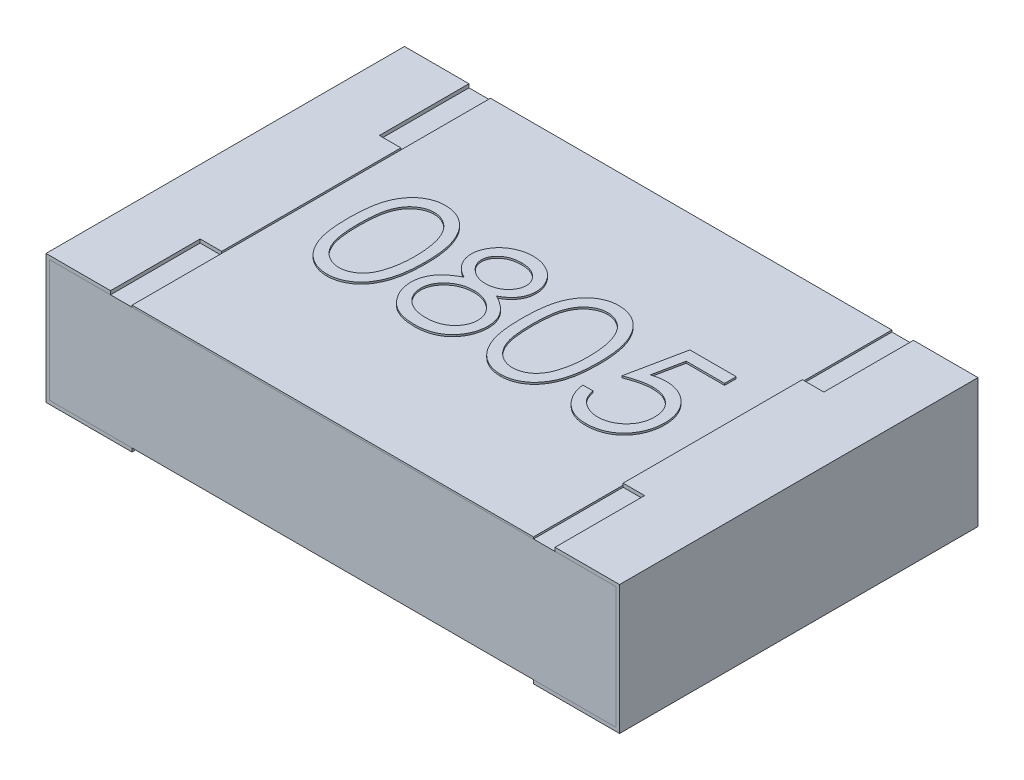
from build123d import *

# Parameters (mm, degrees)
CROQUIS1_W              = 2
CROQUIS1_H              = 1.25
SALIENTE_EXTRUIR1_DEPTH = 0.45
CROQUIS2_W              = 1.4
CROQUIS2_H              = 0.0125
CORTAR_EXTRUIR1_DEPTH   = 2.662828915
CROQUIS3_W              = 0.075
CROQUIS3_H              = 0.3125
CORTAR_EXTRUIR3_DEPTH   = 0.0125
CROQUIS4_W              = 1.4
CROQUIS4_H              = 1.25
SALIENTE_EXTRUIR2_DEPTH = 0.00625
SALIENTE_EXTRUIR2_TAPER = 1
SALIENTE_EXTRUIR3_START = 0.44375
SALIENTE_EXTRUIR3_DEPTH = 0.00625


# Read off the part's stored shape, not the designer's step: Saliente-Extruir3
with BuildPart() as part:
    # Croquis1 → Saliente-Extruir1 (new body)
    with BuildSketch(Plane(origin=(0, 0, 0), x_dir=(1, 0, 0), z_dir=(0, 1, 0))):
        Rectangle(CROQUIS1_W, CROQUIS1_H)
    extrude(amount=SALIENTE_EXTRUIR1_DEPTH)

    # Croquis2 → Cortar-Extruir1 (cut, through all)
    with BuildSketch(Plane.XY.offset(0.625)):
        with Locations((0, 0.00625)):
            Rectangle(CROQUIS2_W, CROQUIS2_H)
        with Locations((0, 0.44375)):
            Rectangle(CROQUIS2_W, CROQUIS2_H)
    extrude(amount=-CORTAR_EXTRUIR1_DEPTH, mode=Mode.SUBTRACT)

    # Croquis3 → Cortar-Extruir3 (cut)
    with BuildSketch(Plane(origin=(0, 0.45, 0), x_dir=(1, 0, 0), z_dir=(0, 1, 0))):
        with Locations((-0.7375, -0.46875)):
            Rectangle(CROQUIS3_W, CROQUIS3_H)
        with Locations((-0.7375, 0.46875)):
            Rectangle(CROQUIS3_W, CROQUIS3_H)
        with Locations((0.7375, 0.46875)):
            Rectangle(CROQUIS3_W, CROQUIS3_H)
        with Locations((0.7375, -0.46875)):
            Rectangle(CROQUIS3_W, CROQUIS3_H)
    extrude(amount=-CORTAR_EXTRUIR3_DEPTH, mode=Mode.SUBTRACT)

    # Croquis4 → Saliente-Extruir2 (add)
    with BuildSketch(Plane(origin=(0, 0.4375, 0), x_dir=(1, 0, 0), z_dir=(0, 1, 0))):
        Rectangle(CROQUIS4_W, CROQUIS4_H)
    extrude(amount=SALIENTE_EXTRUIR2_DEPTH, taper=SALIENTE_EXTRUIR2_TAPER)

    # Saliente-Extruir3 outline → Saliente-Extruir3 (add)
    # profile 1 of 4: a face of its own
    with BuildSketch(Plane(origin=(0, 0, 0), x_dir=(1, 0, 0), z_dir=(0, 1, 0)).offset(SALIENTE_EXTRUIR3_START)):
        with BuildLine():
            add(Edge.make_bspline(
                [(-0.448233935, -0.197441498), (-0.451337673, -0.197389062), (-0.457457638, -0.197285669), (-0.466525997, -0.196215969), (-0.475327881, -0.19449618), (-0.483906723, -0.19208815), (-0.492306538, -0.189140619), (-0.500412866, -0.185300464), (-0.508315839, -0.180877839), (-0.515994372, -0.175841153), (-0.523304178, -0.17007067), (-0.530286391, -0.163688234), (-0.536765605, -0.156534576), (-0.54279609, -0.14872265), (-0.54852749, -0.140324328), (-0.553799614, -0.131224942), (-0.558676126, -0.121460575), (-0.563133541, -0.11096814), (-0.56708557, -0.099594531), (-0.570576497, -0.087209631), (-0.573332808, -0.073704127), (-0.57569208, -0.05918649), (-0.577595015, -0.043594338), (-0.578894155, -0.026919204), (-0.579697107, -0.009171481), (-0.579768512, 0.003002104), (-0.579805201, 0.009257041)],
                knots=[0, 0, 0, 0, 0.033787146, 0.066621658, 0.099284878, 0.131361165, 0.163585188, 0.196103927, 0.228902254, 0.262158056, 0.295991222, 0.330217846, 0.365059826, 0.400950737, 0.437620382, 0.475707529, 0.515380692, 0.556413541, 0.59976483, 0.646424156, 0.696431445, 0.749781518, 0.806573307, 0.867435532, 0.931886753, 1, 1, 1, 1], degree=3))
            add(Edge.make_bspline(
                [(-0.312405718, 0.009257041), (-0.312478981, 0.003238946), (-0.31262173, -0.008487068), (-0.313361423, -0.025637272), (-0.31481846, -0.041828055), (-0.316641071, -0.057098246), (-0.319165401, -0.07138429), (-0.322269258, -0.084735621), (-0.325715504, -0.097209897), (-0.329969554, -0.108704925), (-0.334625672, -0.119381061), (-0.339691566, -0.129350576), (-0.345118906, -0.138701587), (-0.351031854, -0.147359248), (-0.35733436, -0.155384887), (-0.364161318, -0.162636839), (-0.37132028, -0.169289843), (-0.378899965, -0.175209861), (-0.386816865, -0.180391522), (-0.394907765, -0.185025505), (-0.403316223, -0.188762107), (-0.411851687, -0.191970516), (-0.420636247, -0.194421705), (-0.429658952, -0.196116572), (-0.438873908, -0.197305244), (-0.445103122, -0.197395923), (-0.448233935, -0.197441498)],
                knots=[0, 0, 0, 0, 0.06506329, 0.126773166, 0.185515763, 0.240764679, 0.292979796, 0.342250373, 0.388919286, 0.432775664, 0.474628433, 0.514774691, 0.553605893, 0.591426406, 0.62802812, 0.663803634, 0.698984336, 0.733591489, 0.767628469, 0.801208348, 0.83426384, 0.866980695, 0.899719742, 0.932701912, 0.966175883, 1, 1, 1, 1], degree=3))
            add(Edge.make_bspline(
                [(-0.448233935, 0.21627091), (-0.445104182, 0.216216061), (-0.43888009, 0.216106984), (-0.429678161, 0.215058623), (-0.420688818, 0.213319089), (-0.411950383, 0.210854349), (-0.403391078, 0.207796534), (-0.395077852, 0.203963863), (-0.386959067, 0.19950247), (-0.379163742, 0.194260197), (-0.371606297, 0.188415439), (-0.364472366, 0.18180831), (-0.357761298, 0.174505525), (-0.351388867, 0.166585216), (-0.345535865, 0.157895473), (-0.339961951, 0.148587433), (-0.33497287, 0.138498318), (-0.330167889, 0.127796462), (-0.326020407, 0.116185752), (-0.322280033, 0.103731638), (-0.319257829, 0.090287013), (-0.316740435, 0.075922418), (-0.314790218, 0.060585099), (-0.313369835, 0.044307933), (-0.31261953, 0.027080213), (-0.312478229, 0.0153015), (-0.312405718, 0.009257041)],
                knots=[0, 0, 0, 0, 0.033788116, 0.067193932, 0.099862411, 0.132566612, 0.165151173, 0.197913187, 0.231319004, 0.265083278, 0.299255309, 0.334398567, 0.369942824, 0.406283561, 0.44406382, 0.482997707, 0.523354447, 0.56553659, 0.609612924, 0.656390811, 0.705885495, 0.7583245, 0.813831783, 0.872794559, 0.93472223, 1, 1, 1, 1], degree=3))
            add(Edge.make_bspline(
                [(-0.579805201, 0.009257041), (-0.57976832, 0.015564492), (-0.579696677, 0.027816807), (-0.578899673, 0.045670158), (-0.577575682, 0.062418883), (-0.575761236, 0.078063784), (-0.57355319, 0.0926089), (-0.570605586, 0.10601536), (-0.567253509, 0.118345214), (-0.563368517, 0.129638669), (-0.558984827, 0.140047876), (-0.554213624, 0.149765311), (-0.548865557, 0.158776271), (-0.543246277, 0.167224578), (-0.537128318, 0.174971939), (-0.530685784, 0.182127762), (-0.523667224, 0.188526665), (-0.516311223, 0.194356135), (-0.508551183, 0.199466361), (-0.500608297, 0.203967542), (-0.492427893, 0.207812891), (-0.483987638, 0.210836384), (-0.475363393, 0.213333717), (-0.466525009, 0.215041525), (-0.457457894, 0.21611608), (-0.451337759, 0.21621881), (-0.448233935, 0.21627091)],
                knots=[0, 0, 0, 0, 0.068594622, 0.133246042, 0.194312586, 0.251279223, 0.304513439, 0.354234907, 0.400480589, 0.443410755, 0.484014869, 0.523252301, 0.561042373, 0.597900239, 0.633518489, 0.668314351, 0.702495671, 0.736685354, 0.770293169, 0.803437255, 0.835912952, 0.868460246, 0.900846538, 0.933466525, 0.966257575, 1, 1, 1, 1], degree=3))
        make_face()
        with BuildLine():
            add(Edge.make_bspline(
                [(-0.447051449, 0.175908724), (-0.451403972, 0.175680313), (-0.460116947, 0.175223075), (-0.472985191, 0.171996877), (-0.485320076, 0.166373543), (-0.495129459, 0.160194835), (-0.502647458, 0.154310045), (-0.507941319, 0.149206905), (-0.512905005, 0.143624803), (-0.51747758, 0.137507987), (-0.521760245, 0.130934286), (-0.525693423, 0.123851985), (-0.529237153, 0.116225195), (-0.532507346, 0.108060383), (-0.535382687, 0.099112499), (-0.53775444, 0.089243972), (-0.539945516, 0.078398036), (-0.541496622, 0.066511197), (-0.542875528, 0.053661595), (-0.543761687, 0.039800599), (-0.544451071, 0.024951608), (-0.544475634, 0.014697401), (-0.544488289, 0.009414706)],
                knots=[0, 0, 0, 0, 0.060386619, 0.120883249, 0.182754619, 0.24781103, 0.2812991, 0.315087624, 0.349702396, 0.384856581, 0.420966197, 0.458511188, 0.497174722, 0.537602048, 0.580503018, 0.62746754, 0.67838821, 0.733983221, 0.793746705, 0.857713672, 0.926697864, 1, 1, 1, 1], degree=3))
            add(Edge.make_bspline(
                [(-0.347722631, 0.009414706), (-0.347784493, 0.014144679), (-0.347905508, 0.023397519), (-0.348368075, 0.036948284), (-0.349562563, 0.049818755), (-0.350889227, 0.062064378), (-0.352845327, 0.073617367), (-0.354954408, 0.084574438), (-0.35778797, 0.094799846), (-0.360814763, 0.104453684), (-0.364279007, 0.113426272), (-0.368092408, 0.121759442), (-0.372165093, 0.129493426), (-0.376588637, 0.136607003), (-0.381310527, 0.143132039), (-0.386455393, 0.148937704), (-0.391819154, 0.154203937), (-0.399331912, 0.160215135), (-0.409167305, 0.166344295), (-0.421405639, 0.171984809), (-0.434141509, 0.175223942), (-0.442751238, 0.175680628), (-0.447051449, 0.175908724)],
                knots=[0, 0, 0, 0, 0.065681198, 0.128486464, 0.18817513, 0.245106131, 0.299448425, 0.350822936, 0.399941681, 0.446671744, 0.491254533, 0.533376344, 0.573852755, 0.612526312, 0.649597136, 0.685532042, 0.720105786, 0.753837663, 0.818925416, 0.880493462, 0.940311334, 1, 1, 1, 1], degree=3))
            add(Edge.make_bspline(
                [(-0.362621954, -0.08951995), (-0.361435539, -0.086008555), (-0.359026609, -0.078878919), (-0.355922009, -0.067819154), (-0.353477011, -0.056215291), (-0.351277354, -0.044136677), (-0.34977597, -0.031494236), (-0.348567512, -0.018327085), (-0.347855706, -0.004625296), (-0.34776747, 0.004683967), (-0.347722631, 0.009414706)],
                knots=[0, 0, 0, 0, 0.110588339, 0.224541754, 0.342503494, 0.464324098, 0.590756033, 0.722227475, 0.858842836, 1, 1, 1, 1], degree=3))
            add(Edge.make_bspline(
                [(-0.447051449, -0.157079312), (-0.442693632, -0.156899661), (-0.433986997, -0.156540731), (-0.421266513, -0.153077798), (-0.40891747, -0.147852878), (-0.399239755, -0.141674717), (-0.39187706, -0.135791049), (-0.38660183, -0.130774689), (-0.381760041, -0.125157775), (-0.377167859, -0.119097472), (-0.372956053, -0.112477996), (-0.369126079, -0.105331178), (-0.365631144, -0.097637171), (-0.363639983, -0.09226606), (-0.362621954, -0.08951995)],
                knots=[0, 0, 0, 0, 0.112813401, 0.225393884, 0.339594815, 0.45967541, 0.52173519, 0.583925839, 0.648174145, 0.713881038, 0.781004455, 0.851450928, 0.924050693, 1, 1, 1, 1], degree=3))
            add(Edge.make_bspline(
                [(-0.544488289, 0.009414706), (-0.544474858, 0.004158398), (-0.544448793, -0.006043063), (-0.543767848, -0.020867192), (-0.542840213, -0.034693671), (-0.541643732, -0.047540055), (-0.539866888, -0.059362861), (-0.53787598, -0.070243404), (-0.535453167, -0.080124103), (-0.53258657, -0.089072759), (-0.529321486, -0.09724124), (-0.525756557, -0.104842153), (-0.521926854, -0.111965287), (-0.517640831, -0.118546661), (-0.512972981, -0.124607736), (-0.508028737, -0.130255791), (-0.502623575, -0.135292653), (-0.495146059, -0.141333567), (-0.485274441, -0.147576), (-0.472836552, -0.153011915), (-0.460055953, -0.156428043), (-0.451381258, -0.156862474), (-0.447051449, -0.157079312)],
                knots=[0, 0, 0, 0, 0.072951066, 0.141583694, 0.20592646, 0.265301357, 0.320597233, 0.371816503, 0.41878977, 0.461698729, 0.502133582, 0.540804315, 0.578180525, 0.614296865, 0.649678243, 0.68429946, 0.718358953, 0.752080865, 0.817652439, 0.879722076, 0.93996556, 1, 1, 1, 1], degree=3))
        make_face(mode=Mode.SUBTRACT)
    # profile 2 of 4: a face of its own
    with BuildSketch(Plane(origin=(0, 0, 0), x_dir=(1, 0, 0), z_dir=(0, 1, 0)).offset(SALIENTE_EXTRUIR3_START)):
        with BuildLine():
            add(Edge.make_bspline(
                [(-0.029870415, 0.114182959), (-0.030031714, 0.109912957), (-0.030348495, 0.101526916), (-0.033013257, 0.089301976), (-0.037501011, 0.077853358), (-0.043628199, 0.067051154), (-0.051614129, 0.05709127), (-0.0613522, 0.047847054), (-0.072764774, 0.039242568), (-0.081339359, 0.0343868), (-0.085762583, 0.031881938)],
                knots=[0, 0, 0, 0, 0.121904041, 0.239412608, 0.355410104, 0.472090729, 0.592858982, 0.718703468, 0.854892383, 1, 1, 1, 1], degree=3))
            add(Edge.make_bspline(
                [(-0.141575919, 0.21627091), (-0.13657202, 0.216108287), (-0.126704902, 0.215787612), (-0.112201067, 0.213113075), (-0.09832348, 0.208645986), (-0.085119998, 0.202585916), (-0.072826994, 0.195121533), (-0.06196527, 0.186081458), (-0.052370687, 0.175946166), (-0.044434352, 0.164599016), (-0.037894661, 0.15260371), (-0.033340841, 0.140053151), (-0.030422865, 0.127218514), (-0.030054816, 0.118534065), (-0.029870415, 0.114182959)],
                knots=[0, 0, 0, 0, 0.089409711, 0.176305764, 0.262625902, 0.349445726, 0.435498264, 0.51892813, 0.601354657, 0.684256422, 0.76580674, 0.844876866, 0.922279795, 1, 1, 1, 1], degree=3))
            add(Edge.make_bspline(
                [(-0.256907712, 0.115286612), (-0.256723829, 0.119480257), (-0.256354192, 0.127910215), (-0.25336523, 0.14045893), (-0.248494429, 0.152783945), (-0.241869498, 0.164825521), (-0.233618022, 0.176176113), (-0.223718287, 0.186356312), (-0.212406702, 0.195273898), (-0.199739731, 0.202759558), (-0.186108229, 0.208851834), (-0.171725703, 0.213054571), (-0.156842743, 0.215802107), (-0.146712379, 0.216113183), (-0.141575919, 0.21627091)],
                knots=[0, 0, 0, 0, 0.074058426, 0.148870352, 0.226667668, 0.307734759, 0.391157204, 0.473929356, 0.557927752, 0.64498929, 0.733364056, 0.821092042, 0.909287215, 1, 1, 1, 1], degree=3))
            add(Edge.make_bspline(
                [(-0.199438897, 0.031881938), (-0.20400289, 0.034370717), (-0.212840059, 0.039189689), (-0.224541368, 0.048043784), (-0.234592228, 0.057633334), (-0.24271637, 0.068160836), (-0.249110942, 0.079297421), (-0.253498097, 0.090973411), (-0.256466052, 0.102972306), (-0.256760057, 0.111169698), (-0.256907712, 0.115286612)],
                knots=[0, 0, 0, 0, 0.14586006, 0.282425903, 0.4108504, 0.535029421, 0.654701078, 0.770133433, 0.884555844, 1, 1, 1, 1], degree=3))
            add(Edge.make_bspline(
                [(-0.277088805, -0.075960778), (-0.27702383, -0.073199403), (-0.276895415, -0.067741952), (-0.276006614, -0.059679133), (-0.274577706, -0.051831429), (-0.272637096, -0.044169853), (-0.270007067, -0.036750183), (-0.266831591, -0.029537263), (-0.263128804, -0.02252295), (-0.258847052, -0.015668884), (-0.253865843, -0.009071105), (-0.248225567, -0.002617642), (-0.241813494, 0.003591367), (-0.23470096, 0.009631784), (-0.226969246, 0.015610758), (-0.218417526, 0.021205169), (-0.209272503, 0.026811075), (-0.202773006, 0.030162649), (-0.199438897, 0.031881938)],
                knots=[0, 0, 0, 0, 0.058853586, 0.116315459, 0.172674843, 0.228780387, 0.284580359, 0.340256506, 0.396629805, 0.453507263, 0.51231819, 0.572648444, 0.636021936, 0.702362946, 0.771483056, 0.844184477, 0.920069794, 1, 1, 1, 1], degree=3))
            add(Edge.make_bspline(
                [(-0.143940891, -0.197441498), (-0.149226959, -0.197311916), (-0.159513112, -0.197059763), (-0.174485054, -0.195351339), (-0.188441144, -0.192357368), (-0.201462529, -0.188259627), (-0.213470709, -0.182928938), (-0.224431467, -0.176294179), (-0.234502942, -0.168622405), (-0.243379488, -0.159693283), (-0.251260058, -0.150129587), (-0.258182618, -0.140263014), (-0.263936504, -0.130092663), (-0.268808095, -0.119770183), (-0.272537425, -0.109150891), (-0.275120364, -0.098289426), (-0.27676075, -0.087204757), (-0.276979006, -0.079724103), (-0.277088805, -0.075960778)],
                knots=[0, 0, 0, 0, 0.078556433, 0.15286284, 0.223559693, 0.290374944, 0.355403073, 0.418291157, 0.480388564, 0.543072615, 0.604923944, 0.664398309, 0.721942555, 0.778374891, 0.833829941, 0.888861236, 0.94408894, 1, 1, 1, 1], degree=3))
            add(Edge.make_bspline(
                [(-0.039487967, -0.154241346), (-0.042617832, -0.157681234), (-0.048838883, -0.164518502), (-0.05949604, -0.173395535), (-0.071192003, -0.180855697), (-0.083881514, -0.186935406), (-0.097530653, -0.191667436), (-0.112136512, -0.195067829), (-0.127727565, -0.19701552), (-0.138443476, -0.197297063), (-0.143940891, -0.197441498)],
                knots=[0, 0, 0, 0, 0.11928345, 0.237092882, 0.354796044, 0.474576301, 0.597460066, 0.724926155, 0.858883199, 1, 1, 1, 1], degree=3))
            add(Edge.make_bspline(
                [(-0.009689322, -0.07272865), (-0.009776059, -0.076517539), (-0.009947743, -0.084017173), (-0.01144316, -0.095086209), (-0.013682126, -0.105836561), (-0.016951754, -0.11626587), (-0.021192155, -0.12631659), (-0.026417895, -0.135997322), (-0.032333368, -0.145466732), (-0.037084105, -0.151293177), (-0.039487967, -0.154241346)],
                knots=[0, 0, 0, 0, 0.128158186, 0.253673136, 0.377325306, 0.499384555, 0.622918368, 0.745839393, 0.871395285, 1, 1, 1, 1], degree=3))
            add(Edge.make_bspline(
                [(-0.085762583, 0.031881938), (-0.082541412, 0.030202352), (-0.076259051, 0.026926597), (-0.067311588, 0.02165206), (-0.059134569, 0.01609304), (-0.051501123, 0.010512107), (-0.044545361, 0.004695529), (-0.03834506, -0.001379825), (-0.032747064, -0.007562308), (-0.027864264, -0.013956612), (-0.023569506, -0.020545749), (-0.019857704, -0.027347012), (-0.016685031, -0.034345498), (-0.014170598, -0.041617601), (-0.012099297, -0.049056496), (-0.010674084, -0.056758239), (-0.009907607, -0.06467208), (-0.009762696, -0.070020542), (-0.009689322, -0.07272865)],
                knots=[0, 0, 0, 0, 0.07952483, 0.155099976, 0.22721982, 0.295910504, 0.362055881, 0.425520117, 0.485812719, 0.544494706, 0.601459636, 0.657840594, 0.713974472, 0.769467952, 0.826129967, 0.882885359, 0.940700882, 1, 1, 1, 1], degree=3))
        make_face()
        with BuildLine():
            add(Edge.make_bspline(
                [(-0.045006235, -0.073438141), (-0.045108086, -0.070753432), (-0.04530892, -0.065459655), (-0.046583589, -0.05761528), (-0.048822881, -0.050036675), (-0.051895506, -0.042632664), (-0.055986091, -0.035553266), (-0.060803462, -0.028614052), (-0.06661582, -0.022007624), (-0.073183587, -0.015682665), (-0.080341243, -0.009834145), (-0.087949569, -0.004660395), (-0.09595, -0.000303204), (-0.104325607, 0.003240433), (-0.113057792, 0.006027474), (-0.122140132, 0.007974442), (-0.131583262, 0.009199966), (-0.13799837, 0.009342317), (-0.141260589, 0.009414706)],
                knots=[0, 0, 0, 0, 0.057339426, 0.113063332, 0.169181449, 0.22577456, 0.283826304, 0.343454279, 0.405906962, 0.47139226, 0.538002834, 0.603063556, 0.667601831, 0.732225443, 0.79700481, 0.86304799, 0.930356987, 1, 1, 1, 1], degree=3))
            add(Edge.make_bspline(
                [(-0.143546729, -0.157079312), (-0.139864359, -0.15700861), (-0.132689921, -0.156870861), (-0.122223568, -0.155654928), (-0.112346545, -0.153726667), (-0.103078005, -0.150922077), (-0.094314193, -0.147498357), (-0.086203698, -0.143093945), (-0.078537874, -0.138084593), (-0.071694463, -0.132141353), (-0.06546169, -0.125790938), (-0.060027215, -0.119068294), (-0.055309612, -0.112156127), (-0.051606937, -0.104898231), (-0.048646878, -0.097433851), (-0.046519161, -0.089694156), (-0.045206316, -0.08165541), (-0.045073539, -0.076202295), (-0.045006235, -0.073438141)],
                knots=[0, 0, 0, 0, 0.076558933, 0.149161352, 0.218826846, 0.285567139, 0.350313106, 0.414125154, 0.477179161, 0.540368019, 0.60220239, 0.662033654, 0.719934407, 0.775907433, 0.831114864, 0.886667447, 0.942552362, 1, 1, 1, 1], degree=3))
            add(Edge.make_bspline(
                [(-0.241771893, -0.077143264), (-0.241618611, -0.080677277), (-0.241314504, -0.087688676), (-0.238901973, -0.098051263), (-0.235030127, -0.108083057), (-0.229630291, -0.117702306), (-0.222943905, -0.126691698), (-0.214721746, -0.134527331), (-0.20547479, -0.141489628), (-0.194890164, -0.147120559), (-0.183328386, -0.151617482), (-0.170792533, -0.154715806), (-0.157462512, -0.156766829), (-0.148258422, -0.156973509), (-0.143546729, -0.157079312)],
                knots=[0, 0, 0, 0, 0.074898208, 0.148596294, 0.224471235, 0.302322742, 0.381918618, 0.461148696, 0.542417123, 0.626716083, 0.714596831, 0.80490292, 0.900127254, 1, 1, 1, 1], degree=3))
            add(Edge.make_bspline(
                [(-0.141260589, 0.009414706), (-0.144760295, 0.009352456), (-0.151625865, 0.009230336), (-0.16168418, 0.007871023), (-0.171337297, 0.005978768), (-0.180552668, 0.003108144), (-0.189326404, -0.000624387), (-0.197705999, -0.005114528), (-0.205627349, -0.010422191), (-0.212981069, -0.016479944), (-0.219696212, -0.023008005), (-0.225587747, -0.029918655), (-0.230590938, -0.037083458), (-0.23461994, -0.044593411), (-0.237926922, -0.05228949), (-0.240098526, -0.060363358), (-0.241490695, -0.068659798), (-0.241677638, -0.074299675), (-0.241771893, -0.077143264)],
                knots=[0, 0, 0, 0, 0.071268693, 0.139811785, 0.206497432, 0.271535244, 0.336081831, 0.400528388, 0.464983843, 0.530050305, 0.594423409, 0.65558271, 0.714849106, 0.772115064, 0.828999211, 0.885122163, 0.942079353, 1, 1, 1, 1], degree=3))
        make_face(mode=Mode.SUBTRACT)
        with BuildLine():
            add(Edge.make_bspline(
                [(-0.065187328, 0.115523109), (-0.065247133, 0.117392724), (-0.065365838, 0.121103642), (-0.066344051, 0.126583663), (-0.067960434, 0.131939015), (-0.070148814, 0.13721394), (-0.073028316, 0.142334427), (-0.07644239, 0.14738097), (-0.080589592, 0.152240043), (-0.085244104, 0.157024883), (-0.090522529, 0.161453125), (-0.096414695, 0.165347366), (-0.102890394, 0.168654418), (-0.109949778, 0.171340411), (-0.117566849, 0.173357804), (-0.125706524, 0.174868553), (-0.134436673, 0.175720055), (-0.140444181, 0.17584447), (-0.143546729, 0.175908724)],
                knots=[0, 0, 0, 0, 0.050902438, 0.101034043, 0.151083817, 0.203061988, 0.256248434, 0.310846715, 0.3687691, 0.43001504, 0.492519647, 0.556048722, 0.621995683, 0.690192369, 0.761384855, 0.83635622, 0.915487005, 1, 1, 1, 1], degree=3))
            add(Edge.make_bspline(
                [(-0.142127746, 0.049776892), (-0.138782718, 0.049875035), (-0.132125701, 0.050070352), (-0.122312229, 0.05188635), (-0.112770484, 0.054742928), (-0.103602452, 0.058651252), (-0.095045441, 0.063556661), (-0.087417672, 0.069429612), (-0.080784208, 0.076134497), (-0.075213985, 0.083566935), (-0.070895277, 0.091477093), (-0.067533192, 0.099415215), (-0.065569896, 0.107465992), (-0.065313812, 0.112859279), (-0.065187328, 0.115523109)],
                knots=[0, 0, 0, 0, 0.089689936, 0.17849401, 0.266837753, 0.356558176, 0.44533425, 0.530805835, 0.614076217, 0.697707086, 0.77914195, 0.855353591, 0.92855682, 1, 1, 1, 1], degree=3))
            add(Edge.make_bspline(
                [(-0.221590799, 0.114734785), (-0.221513514, 0.11267937), (-0.221360786, 0.108617575), (-0.220179615, 0.102619498), (-0.218419197, 0.096725339), (-0.215647538, 0.091075251), (-0.21232317, 0.085473236), (-0.208220159, 0.080059304), (-0.203330361, 0.074814613), (-0.197817837, 0.069783771), (-0.191812376, 0.065072778), (-0.185450207, 0.060983068), (-0.178811177, 0.057561132), (-0.1719635, 0.054713157), (-0.164837384, 0.052499269), (-0.157476496, 0.050928669), (-0.149879599, 0.049952487), (-0.144732144, 0.049835887), (-0.142127746, 0.049776892)],
                knots=[0, 0, 0, 0, 0.05456395, 0.107826203, 0.161923709, 0.217509701, 0.274498333, 0.334814765, 0.397554947, 0.464754577, 0.53290121, 0.600097214, 0.665354161, 0.731083628, 0.796883494, 0.86329159, 0.930831218, 1, 1, 1, 1], degree=3))
            add(Edge.make_bspline(
                [(-0.143546729, 0.175908724), (-0.14630716, 0.175835477), (-0.151707772, 0.175692175), (-0.159626597, 0.174943495), (-0.167156804, 0.173487067), (-0.174377069, 0.171548789), (-0.1811884, 0.168930346), (-0.187683303, 0.165850119), (-0.19375124, 0.162105268), (-0.199465461, 0.157904467), (-0.204609565, 0.153284083), (-0.20917504, 0.148470214), (-0.212967345, 0.143368318), (-0.216187681, 0.138105302), (-0.218524303, 0.132524963), (-0.220274315, 0.126798388), (-0.221457314, 0.120853211), (-0.221545958, 0.116790112), (-0.221590799, 0.114734785)],
                knots=[0, 0, 0, 0, 0.075243309, 0.147208812, 0.21644709, 0.284025042, 0.350655449, 0.415031318, 0.479629831, 0.544651634, 0.60804424, 0.667827565, 0.725114247, 0.780991708, 0.835527004, 0.889438155, 0.944072089, 1, 1, 1, 1], degree=3))
        make_face(mode=Mode.SUBTRACT)
    # profile 3 of 4: a face of its own
    with BuildSketch(Plane(origin=(0, 0, 0), x_dir=(1, 0, 0), z_dir=(0, 1, 0)).offset(SALIENTE_EXTRUIR3_START)):
        with BuildLine():
            add(Edge.make_bspline(
                [(0.157198858, -0.197441498), (0.154095119, -0.197389062), (0.147975154, -0.197285669), (0.138906795, -0.196215969), (0.130104912, -0.19449618), (0.121526069, -0.19208815), (0.113126254, -0.189140619), (0.105019926, -0.185300464), (0.097116954, -0.180877839), (0.08943842, -0.175841153), (0.082128614, -0.17007067), (0.075146401, -0.163688234), (0.068667187, -0.156534576), (0.062636702, -0.14872265), (0.056905302, -0.140324328), (0.051633178, -0.131224942), (0.046756667, -0.121460575), (0.042299251, -0.11096814), (0.038347222, -0.099594531), (0.034856295, -0.087209631), (0.032099984, -0.073704127), (0.029740713, -0.05918649), (0.027837777, -0.043594338), (0.026538637, -0.026919204), (0.025735686, -0.009171481), (0.02566428, 0.003002104), (0.025627591, 0.009257041)],
                knots=[0, 0, 0, 0, 0.033787146, 0.066621658, 0.099284878, 0.131361165, 0.163585188, 0.196103927, 0.228902254, 0.262158056, 0.295991222, 0.330217846, 0.365059826, 0.400950737, 0.437620382, 0.475707529, 0.515380692, 0.556413541, 0.59976483, 0.646424156, 0.696431445, 0.749781518, 0.806573307, 0.867435532, 0.931886753, 1, 1, 1, 1], degree=3))
            add(Edge.make_bspline(
                [(0.293027074, 0.009257041), (0.292953811, 0.003238946), (0.292811062, -0.008487068), (0.292071369, -0.025637272), (0.290614332, -0.041828055), (0.288791722, -0.057098246), (0.286267391, -0.07138429), (0.283163535, -0.084735621), (0.279717288, -0.097209897), (0.275463238, -0.108704925), (0.27080712, -0.119381061), (0.265741226, -0.129350576), (0.260313887, -0.138701587), (0.254400939, -0.147359248), (0.248098432, -0.155384887), (0.241271474, -0.162636839), (0.234112512, -0.169289843), (0.226532827, -0.175209861), (0.218615927, -0.180391522), (0.210525027, -0.185025505), (0.202116569, -0.188762107), (0.193581105, -0.191970516), (0.184796545, -0.194421705), (0.17577384, -0.196116572), (0.166558884, -0.197305244), (0.16032967, -0.197395923), (0.157198858, -0.197441498)],
                knots=[0, 0, 0, 0, 0.06506329, 0.126773166, 0.185515763, 0.240764679, 0.292979796, 0.342250373, 0.388919286, 0.432775664, 0.474628433, 0.514774691, 0.553605893, 0.591426406, 0.62802812, 0.663803634, 0.698984336, 0.733591489, 0.767628469, 0.801208348, 0.83426384, 0.866980695, 0.899719742, 0.932701912, 0.966175883, 1, 1, 1, 1], degree=3))
            add(Edge.make_bspline(
                [(0.157198858, 0.21627091), (0.16032861, 0.216216061), (0.166552702, 0.216106984), (0.175754631, 0.215058623), (0.184743975, 0.213319089), (0.193482409, 0.210854349), (0.202041714, 0.207796534), (0.21035494, 0.203963863), (0.218473725, 0.19950247), (0.226269051, 0.194260197), (0.233826495, 0.188415439), (0.240960427, 0.18180831), (0.247671494, 0.174505525), (0.254043925, 0.166585216), (0.259896927, 0.157895473), (0.265470841, 0.148587433), (0.270459923, 0.138498318), (0.275264903, 0.127796462), (0.279412385, 0.116185752), (0.283152759, 0.103731638), (0.286174963, 0.090287013), (0.288692358, 0.075922418), (0.290642575, 0.060585099), (0.292062958, 0.044307933), (0.292813263, 0.027080213), (0.292954563, 0.0153015), (0.293027074, 0.009257041)],
                knots=[0, 0, 0, 0, 0.033788116, 0.067193932, 0.099862411, 0.132566612, 0.165151173, 0.197913187, 0.231319004, 0.265083278, 0.299255309, 0.334398567, 0.369942824, 0.406283561, 0.44406382, 0.482997707, 0.523354447, 0.56553659, 0.609612924, 0.656390811, 0.705885495, 0.7583245, 0.813831783, 0.872794559, 0.93472223, 1, 1, 1, 1], degree=3))
            add(Edge.make_bspline(
                [(0.025627591, 0.009257041), (0.025664472, 0.015564492), (0.025736115, 0.027816807), (0.02653312, 0.045670158), (0.02785711, 0.062418883), (0.029671556, 0.078063784), (0.031879602, 0.0926089), (0.034827206, 0.10601536), (0.038179284, 0.118345214), (0.042064275, 0.129638669), (0.046447965, 0.140047876), (0.051219168, 0.149765311), (0.056567236, 0.158776271), (0.062186516, 0.167224578), (0.068304474, 0.174971939), (0.074747008, 0.182127762), (0.081765569, 0.188526665), (0.089121569, 0.194356135), (0.096881609, 0.199466361), (0.104824495, 0.203967542), (0.113004899, 0.207812891), (0.121445154, 0.210836384), (0.1300694, 0.213333717), (0.138907783, 0.215041525), (0.147974898, 0.21611608), (0.154095033, 0.21621881), (0.157198858, 0.21627091)],
                knots=[0, 0, 0, 0, 0.068594622, 0.133246042, 0.194312586, 0.251279223, 0.304513439, 0.354234907, 0.400480589, 0.443410755, 0.484014869, 0.523252301, 0.561042373, 0.597900239, 0.633518489, 0.668314351, 0.702495671, 0.736685354, 0.770293169, 0.803437255, 0.835912952, 0.868460246, 0.900846538, 0.933466525, 0.966257575, 1, 1, 1, 1], degree=3))
        make_face()
        with BuildLine():
            add(Edge.make_bspline(
                [(0.158381343, 0.175908724), (0.154028821, 0.175680313), (0.145315845, 0.175223075), (0.132447601, 0.171996877), (0.120112716, 0.166373543), (0.110303333, 0.160194835), (0.102785335, 0.154310045), (0.097491473, 0.149206905), (0.092527787, 0.143624803), (0.087955212, 0.137507987), (0.083672548, 0.130934286), (0.079739369, 0.123851985), (0.076195639, 0.116225195), (0.072925446, 0.108060383), (0.070050105, 0.099112499), (0.067678352, 0.089243972), (0.065487276, 0.078398036), (0.06393617, 0.066511197), (0.062557264, 0.053661595), (0.061671105, 0.039800599), (0.060981722, 0.024951608), (0.060957158, 0.014697401), (0.060944504, 0.009414706)],
                knots=[0, 0, 0, 0, 0.060386619, 0.120883249, 0.182754619, 0.24781103, 0.2812991, 0.315087624, 0.349702396, 0.384856581, 0.420966197, 0.458511188, 0.497174722, 0.537602048, 0.580503018, 0.62746754, 0.67838821, 0.733983221, 0.793746705, 0.857713672, 0.926697864, 1, 1, 1, 1], degree=3))
            add(Edge.make_bspline(
                [(0.257710161, 0.009414706), (0.257648299, 0.014144679), (0.257527284, 0.023397519), (0.257064717, 0.036948284), (0.255870229, 0.049818755), (0.254543565, 0.062064378), (0.252587465, 0.073617367), (0.250478384, 0.084574438), (0.247644822, 0.094799846), (0.244618029, 0.104453684), (0.241153785, 0.113426272), (0.237340384, 0.121759442), (0.233267699, 0.129493426), (0.228844155, 0.136607003), (0.224122265, 0.143132039), (0.2189774, 0.148937704), (0.213613638, 0.154203937), (0.20610088, 0.160215135), (0.196265488, 0.166344295), (0.184027153, 0.171984809), (0.171291283, 0.175223942), (0.162681554, 0.175680628), (0.158381343, 0.175908724)],
                knots=[0, 0, 0, 0, 0.065681198, 0.128486464, 0.18817513, 0.245106131, 0.299448425, 0.350822936, 0.399941681, 0.446671744, 0.491254533, 0.533376344, 0.573852755, 0.612526312, 0.649597136, 0.685532042, 0.720105786, 0.753837663, 0.818925416, 0.880493462, 0.940311334, 1, 1, 1, 1], degree=3))
            add(Edge.make_bspline(
                [(0.242810838, -0.08951995), (0.243997253, -0.086008555), (0.246406183, -0.078878919), (0.249510783, -0.067819154), (0.251955781, -0.056215291), (0.254155438, -0.044136677), (0.255656822, -0.031494236), (0.25686528, -0.018327085), (0.257577086, -0.004625296), (0.257665322, 0.004683967), (0.257710161, 0.009414706)],
                knots=[0, 0, 0, 0, 0.110588339, 0.224541754, 0.342503494, 0.464324098, 0.590756033, 0.722227475, 0.858842836, 1, 1, 1, 1], degree=3))
            add(Edge.make_bspline(
                [(0.158381343, -0.157079312), (0.16273916, -0.156899661), (0.171445796, -0.156540731), (0.184166279, -0.153077798), (0.196515322, -0.147852878), (0.206193037, -0.141674717), (0.213555732, -0.135791049), (0.218830962, -0.130774689), (0.223672752, -0.125157775), (0.228264933, -0.119097472), (0.232476739, -0.112477996), (0.236306713, -0.105331178), (0.239801648, -0.097637171), (0.241792809, -0.09226606), (0.242810838, -0.08951995)],
                knots=[0, 0, 0, 0, 0.112813401, 0.225393884, 0.339594815, 0.45967541, 0.52173519, 0.583925839, 0.648174145, 0.713881038, 0.781004455, 0.851450928, 0.924050693, 1, 1, 1, 1], degree=3))
            add(Edge.make_bspline(
                [(0.060944504, 0.009414706), (0.060957934, 0.004158398), (0.060983999, -0.006043063), (0.061664944, -0.020867192), (0.062592579, -0.034693671), (0.06378906, -0.047540055), (0.065565905, -0.059362861), (0.067556812, -0.070243404), (0.069979626, -0.080124103), (0.072846222, -0.089072759), (0.076111306, -0.09724124), (0.079676235, -0.104842153), (0.083505938, -0.111965287), (0.087791961, -0.118546661), (0.092459811, -0.124607736), (0.097404056, -0.130255791), (0.102809218, -0.135292653), (0.110286733, -0.141333567), (0.120158351, -0.147576), (0.132596241, -0.153011915), (0.145376839, -0.156428043), (0.154051534, -0.156862474), (0.158381343, -0.157079312)],
                knots=[0, 0, 0, 0, 0.072951066, 0.141583694, 0.20592646, 0.265301357, 0.320597233, 0.371816503, 0.41878977, 0.461698729, 0.502133582, 0.540804315, 0.578180525, 0.614296865, 0.649678243, 0.68429946, 0.718358953, 0.752080865, 0.817652439, 0.879722076, 0.93996556, 1, 1, 1, 1], degree=3))
        make_face(mode=Mode.SUBTRACT)
    # profile 4 of 4: a face of its own
    with BuildSketch(Plane(origin=(0, 0, 0), x_dir=(1, 0, 0), z_dir=(0, 1, 0)).offset(SALIENTE_EXTRUIR3_START)):
        with BuildLine():
            add(Edge.make_bspline(
                [(0.46046708, 0.029595799), (0.457416771, 0.029530519), (0.451118656, 0.029395732), (0.441457706, 0.028403302), (0.431305529, 0.026802271), (0.420701041, 0.024600042), (0.409612396, 0.021718148), (0.398062994, 0.018264685), (0.386028552, 0.014135755), (0.377919814, 0.011017614), (0.373751446, 0.009414706)],
                knots=[0, 0, 0, 0, 0.102203037, 0.211023342, 0.325099662, 0.446502097, 0.573787718, 0.70890071, 0.850357871, 1, 1, 1, 1], degree=3))
            add(Edge.make_bspline(
                [(0.555381284, -0.0572775), (0.555307246, -0.054120732), (0.555162328, -0.047941808), (0.553978296, -0.038901921), (0.551918781, -0.030348457), (0.549060183, -0.022240111), (0.545430756, -0.014569237), (0.54099551, -0.007327917), (0.535671212, -0.000611593), (0.529589254, 0.005582877), (0.522926427, 0.011299749), (0.515568095, 0.01617325), (0.507668243, 0.020273163), (0.499322051, 0.023811346), (0.490330996, 0.026352518), (0.480873131, 0.028260345), (0.470846323, 0.02936396), (0.46399093, 0.029517088), (0.46046708, 0.029595799)],
                knots=[0, 0, 0, 0, 0.065351382, 0.127916032, 0.188360206, 0.247216077, 0.305630129, 0.36376984, 0.422660914, 0.482687294, 0.543300221, 0.604117955, 0.664964891, 0.727413494, 0.791467625, 0.858055443, 0.927036815, 1, 1, 1, 1], degree=3))
            add(Edge.make_bspline(
                [(0.45550064, -0.157079312), (0.458869093, -0.156987026), (0.465501604, -0.156805313), (0.475262461, -0.155406702), (0.484686173, -0.153252672), (0.493679753, -0.150029105), (0.50240058, -0.146111251), (0.510628057, -0.141083599), (0.518600201, -0.135297562), (0.526069215, -0.128668625), (0.532909852, -0.121363594), (0.538954057, -0.113551728), (0.543988662, -0.105218214), (0.548231391, -0.096507324), (0.551453097, -0.08732359), (0.55375143, -0.07771005), (0.555101025, -0.067642959), (0.555286679, -0.060776478), (0.555381284, -0.0572775)],
                knots=[0, 0, 0, 0, 0.064207295, 0.12642469, 0.187680284, 0.248216424, 0.30830506, 0.369660991, 0.431698552, 0.495946892, 0.559758024, 0.622295408, 0.683910635, 0.745092408, 0.806740225, 0.869086618, 0.933290003, 1, 1, 1, 1], degree=3))
            add(Edge.make_bspline(
                [(0.368706173, -0.086445486), (0.369575153, -0.090198252), (0.37124538, -0.097411275), (0.37491149, -0.10754542), (0.37939391, -0.116576314), (0.384723937, -0.12462342), (0.391082282, -0.131640533), (0.398337811, -0.137893977), (0.406472409, -0.143535545), (0.415511625, -0.148237993), (0.425047797, -0.152248499), (0.435028562, -0.15491908), (0.445182158, -0.156796887), (0.452049659, -0.156984856), (0.45550064, -0.157079312)],
                knots=[0, 0, 0, 0, 0.094687252, 0.181994156, 0.264376949, 0.342179862, 0.418617611, 0.496509075, 0.577369092, 0.661510592, 0.746732551, 0.831257984, 0.915205616, 1, 1, 1, 1], degree=3))
            Line((0.368706173, -0.086445486), (0.33338926, -0.086445486))
            add(Edge.make_bspline(
                [(0.453450997, -0.197441498), (0.449529831, -0.197363822), (0.441815399, -0.197211003), (0.430513116, -0.195612312), (0.419638766, -0.193322644), (0.409279886, -0.189877978), (0.39934364, -0.185561806), (0.389963797, -0.180106768), (0.380900684, -0.173925054), (0.372522735, -0.166630068), (0.364746993, -0.158656485), (0.357786379, -0.150003558), (0.351587297, -0.140814103), (0.346249016, -0.13104349), (0.341695519, -0.120717393), (0.338118321, -0.109797124), (0.335231111, -0.098339741), (0.334009655, -0.090451854), (0.33338926, -0.086445486)],
                knots=[0, 0, 0, 0, 0.065421144, 0.128708372, 0.190236142, 0.250724402, 0.310637179, 0.370766408, 0.431614744, 0.493522974, 0.555883455, 0.617342367, 0.678668039, 0.74071136, 0.802985363, 0.86680258, 0.932347171, 1, 1, 1, 1], degree=3))
            add(Edge.make_bspline(
                [(0.590698197, -0.058775316), (0.590623417, -0.061982283), (0.590474869, -0.068352879), (0.589719448, -0.077813844), (0.588264988, -0.087074517), (0.586312204, -0.096136126), (0.58377759, -0.104981515), (0.580709277, -0.113636002), (0.576954311, -0.122045722), (0.57283557, -0.130290248), (0.568197918, -0.138183194), (0.563050696, -0.145564603), (0.5576126, -0.152545205), (0.551761196, -0.159050135), (0.545442096, -0.165036648), (0.538731828, -0.170540271), (0.531683939, -0.175654079), (0.524189389, -0.180170492), (0.51641518, -0.184326515), (0.508249043, -0.187736018), (0.499876867, -0.190784258), (0.491178152, -0.19321398), (0.482172603, -0.195117835), (0.472845373, -0.196410934), (0.463245383, -0.197352759), (0.45673806, -0.197411717), (0.453450997, -0.197441498)],
                knots=[0, 0, 0, 0, 0.044014471, 0.087434124, 0.130118399, 0.172553695, 0.214554756, 0.256298092, 0.298438225, 0.340849003, 0.382715189, 0.423924045, 0.464246243, 0.504073671, 0.543861906, 0.583566725, 0.623094319, 0.663229061, 0.703551259, 0.743937895, 0.784541255, 0.825750111, 0.867757363, 0.910745164, 0.954914447, 1, 1, 1, 1], degree=3))
            add(Edge.make_bspline(
                [(0.466852504, 0.069957985), (0.471246983, 0.06986287), (0.479887626, 0.069675851), (0.492529982, 0.067880015), (0.504598227, 0.065053346), (0.51606712, 0.061104481), (0.52695788, 0.056054943), (0.537170306, 0.049747204), (0.546857687, 0.042378799), (0.555846234, 0.033907193), (0.564000688, 0.024583692), (0.571170377, 0.014559003), (0.577260284, 0.003930547), (0.582158148, -0.007403224), (0.586069212, -0.019317008), (0.588672365, -0.031936161), (0.590405781, -0.045141736), (0.590599442, -0.054170983), (0.590698197, -0.058775316)],
                knots=[0, 0, 0, 0, 0.065807646, 0.129394274, 0.190894061, 0.251281069, 0.310814964, 0.370370987, 0.430768263, 0.492881251, 0.555103948, 0.616067051, 0.677256033, 0.738259805, 0.800762134, 0.864777582, 0.931045295, 1, 1, 1, 1], degree=3))
            add(Edge.make_bspline(
                [(0.420499056, 0.062311243), (0.424665527, 0.063461509), (0.432737405, 0.065689968), (0.444651268, 0.068164243), (0.455961606, 0.069655776), (0.463301007, 0.069859435), (0.466852504, 0.069957985)],
                knots=[0, 0, 0, 0, 0.275068369, 0.53290146, 0.77397346, 1, 1, 1, 1], degree=3))
            Line((0.420499056, 0.062311243), (0.44170497, 0.165818177))
            Line((0.44170497, 0.165818177), (0.575562377, 0.165818177))
            Line((0.575562377, 0.165818177), (0.575562377, 0.206180363))
            Line((0.575562377, 0.206180363), (0.414113632, 0.206180363))
            Line((0.414113632, 0.206180363), (0.373751446, 0.009414706))
        make_face()
    extrude(amount=SALIENTE_EXTRUIR3_DEPTH)


solid = part.part
